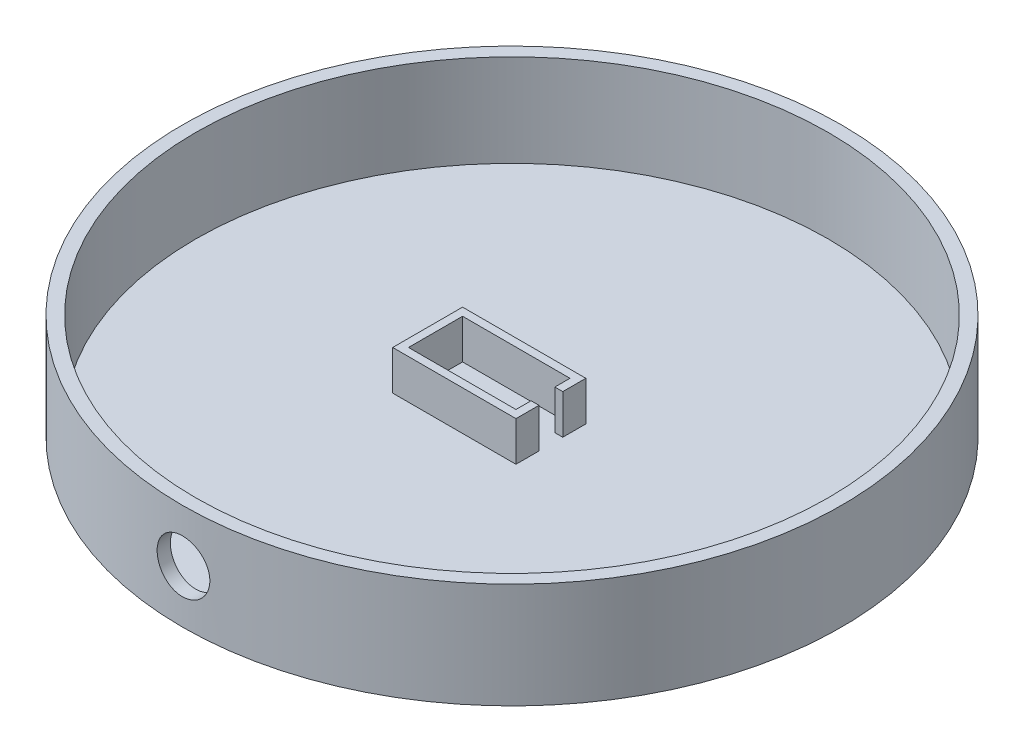
from build123d import *

# Parameters (mm, degrees)
SKETCH1_R           = 125
BOSS_EXTRUDE1_DEPTH = 40
SKETCH2_R           = 120
CUT_EXTRUDE1_DEPTH  = 35
SKETCH3_W           = 46.75
SKETCH3_H           = 26.5
BOSS_EXTRUDE2_DEPTH = 15
SKETCH4_W           = 3
SKETCH4_H           = 9
CUT_EXTRUDE2_DEPTH  = 15
SKETCH7_R           = 10
CUT_EXTRUDE3_DEPTH  = 193


with BuildPart() as part:
    # Sketch1 → Boss-Extrude1 (new body)
    with BuildSketch(Plane(origin=(0, 0, 0), x_dir=(1, 0, 0), z_dir=(0, 1, 0))):
        Circle(SKETCH1_R)
    extrude(amount=BOSS_EXTRUDE1_DEPTH)

    # Sketch2 → Cut-Extrude1 (cut)
    with BuildSketch(Plane(origin=(0, 40, 0), x_dir=(1, 0, 0), z_dir=(0, 1, 0))):
        Circle(SKETCH2_R)
    extrude(amount=-CUT_EXTRUDE1_DEPTH, mode=Mode.SUBTRACT)

    # Sketch3 → Boss-Extrude2 (add)
    with BuildSketch(Plane(origin=(0, 5, 0), x_dir=(1, 0, 0), z_dir=(0, 1, 0))):
        with Locations((-8.625, 0)):
            Rectangle(SKETCH3_W, SKETCH3_H)
        Polygon((0, 10.25), (11.75, 10.25), (11.75, -10.25), (0, -10.25), (-29, -10.25), (-29, 10.25), align=None, mode=Mode.SUBTRACT)
    extrude(amount=BOSS_EXTRUDE2_DEPTH)

    # Sketch4 → Cut-Extrude2 (cut)
    with BuildSketch(Plane(origin=(0, 20, 0), x_dir=(1, 0, 0), z_dir=(0, 1, 0))):
        with Locations((13.25, 0)):
            Rectangle(SKETCH4_W, SKETCH4_H)
    extrude(amount=-CUT_EXTRUDE2_DEPTH, mode=Mode.SUBTRACT)

    # Sketch7 → Cut-Extrude3 (cut)
    with BuildSketch(Plane.XY.offset(13.25)):
        with Locations((0, 20)):
            Circle(SKETCH7_R)
    extrude(amount=CUT_EXTRUDE3_DEPTH, mode=Mode.SUBTRACT)


solid = part.part
